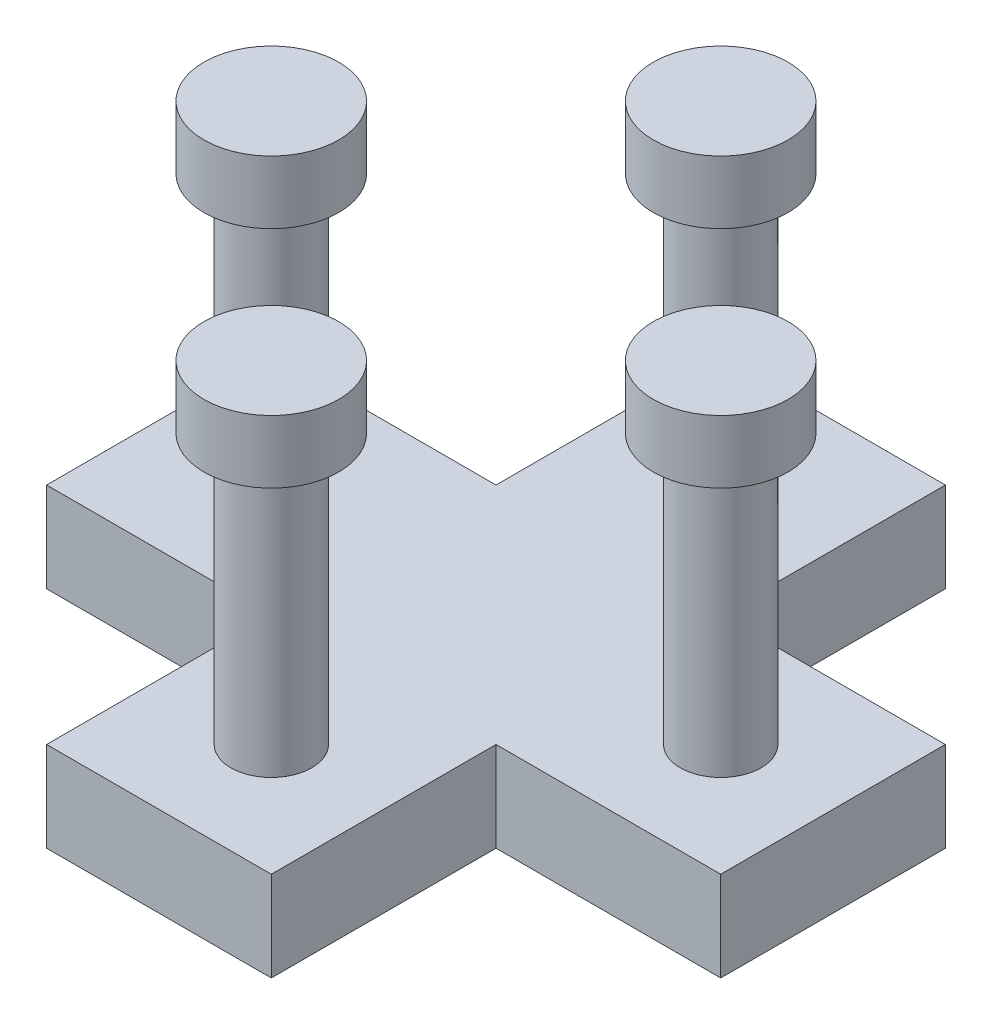
from build123d import *

# Parameters (mm, degrees)
BODY_DEPTH = 2.54
SKETCH2_R  = 1.143
PEGS_DEPTH = 7.62
SKETCH3_R  = 1.905
FEET_DEPTH = 1.778


with BuildPart() as part:
    # Sketch1 → body (new body)
    with BuildSketch(Plane(origin=(0, 0, 0), x_dir=(1, 0, 0), z_dir=(0, 1, 0))):
        Polygon((-8.348684361, -10.452067183), (-8.348684361, -4.102067183), (-1.998684361, -4.102067183), (-1.998684361, -10.452067183), (4.351315639, -10.452067183), (4.351315639, -16.802067183), (-1.998684361, -16.802067183), (-1.998684361, -23.152067183), (-8.348684361, -23.152067183), (-8.348684361, -16.802067183), (-14.698684361, -16.802067183), (-14.698684361, -10.452067183), align=None)
    extrude(amount=BODY_DEPTH)

    # Sketch2 → pegs (add)
    with BuildSketch(Plane(origin=(0, 2.54, 0), x_dir=(1, 0, 0), z_dir=(0, 1, 0))):
        with Locations((-5.173684361, -7.277067183)):
            Circle(SKETCH2_R)
        with Locations((1.176315639, -13.627067183)):
            Circle(SKETCH2_R)
        with Locations((-5.173684361, -19.977067183)):
            Circle(SKETCH2_R)
        with Locations((-11.523684361, -13.627067183)):
            Circle(SKETCH2_R)
    extrude(amount=PEGS_DEPTH)

    # Sketch3 → feet (add)
    with BuildSketch(Plane(origin=(0, 10.16, 0), x_dir=(1, 0, 0), z_dir=(0, 1, 0))):
        with Locations((-5.173684361, -7.277067183)):
            Circle(SKETCH3_R)
        with Locations((-11.523684361, -13.627067183)):
            Circle(SKETCH3_R)
        with Locations((-5.173684361, -19.977067183)):
            Circle(SKETCH3_R)
        with Locations((1.176315639, -13.627067183)):
            Circle(SKETCH3_R)
    extrude(amount=FEET_DEPTH)


solid = part.part
